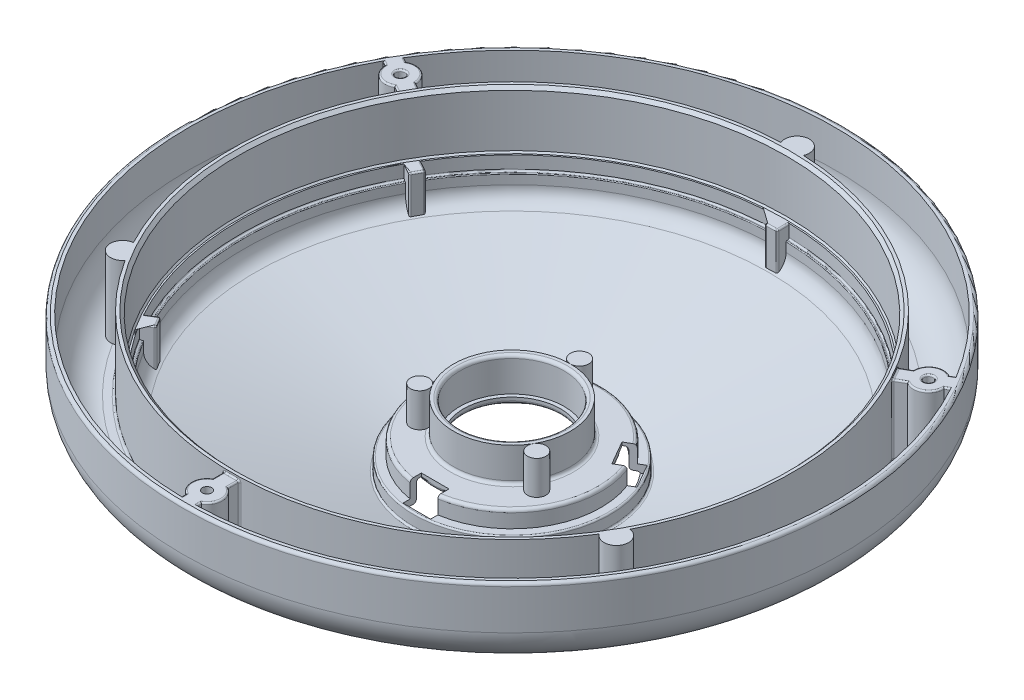
from build123d import *

# Parameters (mm, degrees)
SKETCH2_R             = 3.0000000000000036
BOSS_EXTRUDE3_DEPTH   = 11
SKETCH2_R_2           = 3.000000000000003
BOSS_EXTRUDE3_2_DEPTH = 11
BOSS_EXTRUDE3_3_DEPTH = 11
BOSS_EXTRUDE4_DEPTH   = 24
BOSS_EXTRUDE6_REACH   = 156.418
FILLET1_R             = 0.5
BOSS_EXTRUDE7_REACH   = 160.624
SKETCH8_R             = 1.5000000000000009
SKETCH8_R_2           = 1.4999999999999918
SKETCH8_R_3           = 1.5000000000000022
FILLET2_R             = 0.5
CUT_EXTRUDE1_DEPTH    = 8


with BuildPart() as part:
    # Sketch1 → Revolve1 (revolve)
    with BuildSketch(Plane.XY, mode=Mode.PRIVATE) as revolve1_sk:
        with BuildLine():
            Line((-106.26500000000001, 46.5), (-105.26500000000001, 46.5))
            Line((-105.26500000000001, 46.5), (-105.265, 34.50000000000008))
            ThreePointArc((-105.265, 34.50000000000008), (-102.04317459305202, 26.721825406947975), (-94.26499999999992, 23.500000000000004))
            Line((-94.26499999999992, 23.500000000000004), (-92.015, 23.500000000000004))
            ThreePointArc((-92.015, 23.500000000000004), (-91.48466991411009, 23.719669914110096), (-91.265, 24.250000000000007))
            Line((-91.265, 24.250000000000007), (-91.265, 47.5))
            Line((-91.265, 47.5), (-90.265, 47.5))
            Line((-90.265, 47.5), (-89.265, 46.5))
            Line((-89.265, 46.5), (-89.265, 29.500000000000004))
            Line((-89.265, 29.500000000000004), (-88.765, 29))
            Line((-88.765, 29), (-88.265, 29))
            Line((-88.265, 29), (-88.265, 25.000000000000004))
            ThreePointArc((-88.265, 25.000000000000004), (-88.11855339059328, 24.646446609406727), (-87.765, 24.5))
            Line((-87.765, 24.5), (-87.515, 24.5))
            ThreePointArc((-87.515, 24.5), (-87.33822330470336, 24.42677669529664), (-87.265, 24.25))
            Line((-87.265, 24.25), (-87.265, 21.290597645166347))
            ThreePointArc((-87.265, 21.290597645166347), (-86.24941764691893, 18.26993281521231), (-83.61523359403155, 16.476361543607876))
            Line((-83.61523359403155, 16.476361543607876), (-32.635023359403164, 2.1781029959422606))
            ThreePointArc((-32.635023359403164, 2.1781029959422606), (-32.1979335170046, 2.26108484140621), (-32, 2.6595266060981078))
            Line((-32, 2.6595266060981078), (-32, 5.999999999999996))
            ThreePointArc((-32, 5.999999999999996), (-31.853553390593277, 6.353553390593272), (-31.5, 6.5))
            Line((-31.5, 6.5), (-29, 6.5))
            Line((-29, 6.5), (-29, 10.999999999999993))
            ThreePointArc((-29, 10.999999999999993), (-28.70710678118655, 11.707106781186548), (-27.999999999999993, 12))
            Line((-27.999999999999993, 12), (-20.00000000000001, 12))
            ThreePointArc((-20.00000000000001, 12), (-19.292893218813454, 12.292893218813454), (-19.000000000000004, 13.000000000000009))
            Line((-19.000000000000004, 13.000000000000009), (-19.000000000000007, 23))
            Line((-19.000000000000007, 23), (-18.000000000000014, 23))
            ThreePointArc((-18.000000000000014, 23), (-17.29289321881346, 22.707106781186546), (-17.000000000000004, 21.999999999999993))
            Line((-17.000000000000004, 21.999999999999993), (-17.000000000000007, 12))
            Line((-17.000000000000007, 12), (-15.75, 12))
            Line((-15.75, 12), (-15.75, 11.000000000000009))
            ThreePointArc((-15.75, 11.000000000000009), (-16.04289321881345, 10.292893218813454), (-16.750000000000007, 10))
            Line((-16.750000000000007, 10), (-24.75, 10))
            ThreePointArc((-24.75, 10), (-24.92677669529664, 10.073223304703363), (-25, 10.250000000000002))
            Line((-25, 10.250000000000002), (-25, 10.499999999999995))
            ThreePointArc((-25, 10.499999999999995), (-25.146446609406727, 10.853553390593271), (-25.500000000000004, 11))
            Line((-25.500000000000004, 11), (-25.999999999999996, 11))
            ThreePointArc((-25.999999999999996, 11), (-26.707106781186553, 10.707106781186546), (-27.000000000000004, 9.999999999999991))
            Line((-27.000000000000004, 9.999999999999991), (-27.000000000000004, 5.500000000000006))
            ThreePointArc((-27.000000000000004, 5.500000000000006), (-27.292893218813457, 4.792893218813452), (-28.00000000000001, 4.5))
            Line((-28.00000000000001, 4.5), (-28.858251601619305, 4.500000000000001))
            ThreePointArc((-28.858251601619305, 4.500000000000001), (-29.565358382805854, 4.20710678118655), (-29.858251601619305, 3.5))
            Line((-29.858251601619305, 3.5), (-29.858251601619312, 0.6318155195259662))
            ThreePointArc((-29.858251601619312, 0.6318155195259662), (-30.047971579730543, 0.23973605306960133), (-30.473156833686136, 0.14519781778909666))
            Line((-30.473156833686136, 0.14519781778909666), (-87.41405232066815, 13.590674187989013))
            ThreePointArc((-87.41405232066815, 13.590674187989013), (-90.1857946645636, 15.354050986469991), (-91.265, 18.45685120535772))
            Line((-91.265, 18.45685120535772), (-91.265, 20.999999999999993))
            ThreePointArc((-91.265, 20.999999999999993), (-91.41144660940672, 21.353553390593273), (-91.765, 21.5))
            Line((-91.765, 21.5), (-96.26499999999993, 21.5))
            ThreePointArc((-96.26499999999993, 21.5), (-104.04317459305203, 24.72182540694797), (-107.265, 32.500000000000064))
            Line((-107.265, 32.500000000000064), (-107.26500000000001, 45.49999999999999))
            ThreePointArc((-107.26500000000001, 45.49999999999999), (-106.97210678118657, 46.207106781186546), (-106.26500000000001, 46.5))
        make_face()
    revolve(revolve1_sk.sketch.rotate(Axis((0, 0, 0), (0, 1, 0)), 270), axis=Axis((0, 0, 0), (0, 1, 0)))

    # Sketch3 → Boss-Extrude4 (add, through all)
    with BuildSketch(Plane(origin=(0, 23.500000000000004, 0), x_dir=(1, 0, 0), z_dir=(0, 1, 0))):
        with BuildLine():
            ThreePointArc((80.81225085960907, -42.41085163025632), (79.94126044781225, -44.03061551937523), (79.03780847638726, -45.63249999999917))
            ThreePointArc((79.03780847638726, -45.63249999999917), (78.10226180795067, -47.215854598665516), (77.13500033773872, -48.78003636629482))
            ThreePointArc((77.1350003377387, -48.78003636629483), (83.80094819720091, -48.382500000000384), (80.81225085960907, -42.41085163025633))
        make_face()
        with BuildLine():
            ThreePointArc((-77.13500033773943, -48.78003636629374), (-79.03780847638723, -45.632499999999226), (-80.81225085960966, -42.410851630255166))
            ThreePointArc((-80.81225085960965, -42.410851630255166), (-83.80094819720165, -48.38249999999917), (-77.13500033773943, -48.78003636629375))
        make_face()
        with BuildLine():
            ThreePointArc((-3.6772505218690332, 91.19088799655049), (1.26843e-12, 91.26499999999996), (3.6772505218715668, 91.19088799655034))
            ThreePointArc((3.6772505218715583, 91.19088799655033), (1.35947e-12, 96.7649999999999), (-3.677250521869044, 91.19088799655047))
        make_face()
    extrude(amount=BOSS_EXTRUDE4_DEPTH)

    # Sketch6 → Boss-Extrude6 (add, up to next)
    with BuildSketch(Plane(origin=(0, 29, 0), x_dir=(1, 0, 0), z_dir=(0, 1, 0)), mode=Mode.PRIVATE) as boss_extrude6_sk1:
        Polygon((71.99425942771423, -43.93083632540869), (75.50601778287276, -45.84592202975051), (77.42110348721458, -42.33416367459199), (73.90934513205603, -40.41907797025018), align=None)
    boss_extrude6_tool1 = extrude(boss_extrude6_sk1.sketch, amount=-BOSS_EXTRUDE6_REACH, mode=Mode.PRIVATE) - part.part
    # Sketch6 → Boss-Extrude6 (add, up to next)
    with BuildSketch(Plane(origin=(0, 29, 0), x_dir=(1, 0, 0), z_dir=(0, 1, 0)), mode=Mode.PRIVATE) as boss_extrude6_sk2:
        Polygon((-2.048090553443231, -84.31427575375221), (-1.9507242462483698, -88.31309055344269), (2.0480905534420653, -88.2157242462478), (1.950724246247211, -84.21690944655735), align=None)
    boss_extrude6_tool2 = extrude(boss_extrude6_sk2.sketch, amount=-BOSS_EXTRUDE6_REACH, mode=Mode.PRIVATE) - part.part
    # Sketch6 → Boss-Extrude6 (add, up to next)
    with BuildSketch(Plane(origin=(0, 29, 0), x_dir=(1, 0, 0), z_dir=(0, 1, 0)), mode=Mode.PRIVATE) as boss_extrude6_sk3:
        Polygon((-74.04234998115749, -40.38343942834317), (-77.4567420291212, -42.46716852369184), (-75.37301293377254, -45.881560571655505), (-71.95862088580884, -43.797831476306854), align=None)
    boss_extrude6_tool3 = extrude(boss_extrude6_sk3.sketch, amount=-BOSS_EXTRUDE6_REACH, mode=Mode.PRIVATE) - part.part
    # Sketch6 → Boss-Extrude6 (add, up to next)
    with BuildSketch(Plane(origin=(0, 29, 0), x_dir=(1, 0, 0), z_dir=(0, 1, 0)), mode=Mode.PRIVATE) as boss_extrude6_sk4:
        Polygon((-71.99425942771394, 43.9308363254092), (-75.5060177828725, 45.84592202975103), (-77.42110348721428, 42.33416367459251), (-73.90934513205576, 40.41907797025068), align=None)
    boss_extrude6_tool4 = extrude(boss_extrude6_sk4.sketch, amount=-BOSS_EXTRUDE6_REACH, mode=Mode.PRIVATE) - part.part
    # Sketch6 → Boss-Extrude6 (add, up to next)
    with BuildSketch(Plane(origin=(0, 29, 0), x_dir=(1, 0, 0), z_dir=(0, 1, 0)), mode=Mode.PRIVATE) as boss_extrude6_sk5:
        Polygon((2.048090553443835, 84.3142757537522), (1.9507242462490013, 88.31309055344266), (-2.048090553441434, 88.2157242462478), (-1.9507242462466072, 84.21690944655737), align=None)
    boss_extrude6_tool5 = extrude(boss_extrude6_sk5.sketch, amount=-BOSS_EXTRUDE6_REACH, mode=Mode.PRIVATE) - part.part
    # Sketch6 → Boss-Extrude6 (add, up to next)
    with BuildSketch(Plane(origin=(0, 29, 0), x_dir=(1, 0, 0), z_dir=(0, 1, 0)), mode=Mode.PRIVATE) as boss_extrude6_sk6:
        Polygon((74.04234998115774, 40.38343942834264), (77.45674202912147, 42.46716852369128), (75.37301293377286, 45.881560571654944), (71.95862088580915, 43.79783147630633), align=None)
    boss_extrude6_tool6 = extrude(boss_extrude6_sk6.sketch, amount=-BOSS_EXTRUDE6_REACH, mode=Mode.PRIVATE) - part.part
    add(boss_extrude6_tool1.solids().sort_by_distance((74.707681, 29, 43.1325))[0])
    add(boss_extrude6_tool2.solids().sort_by_distance((0, 29, 86.265))[0])
    add(boss_extrude6_tool3.solids().sort_by_distance((-74.707681, 29, 43.1325))[0])
    add(boss_extrude6_tool4.solids().sort_by_distance((-74.707681, 29, -43.1325))[0])
    add(boss_extrude6_tool5.solids().sort_by_distance((0, 29, -86.265))[0])
    add(boss_extrude6_tool6.solids().sort_by_distance((74.707681, 29, -43.1325))[0])

    # Fillet1
    fillet1_edges = [part.edges().sort_by_distance(p)[0] for p in [
        (2.000255796517047, 29, -86.27883967169635),
        (2.048090553443835, 22.87055087546162, -84.3142757537522),
        (0.04868315359861386, 29, -84.26559260015478),
        (-1.9507242462466072, 22.8484882948539, -84.21690944655737),
        (-1.9994073998440207, 29, -86.21631684640258),
        (75.71979486299225, 29, -41.407147501997144),
        (74.04234998115774, 22.87055087546161, -40.38343942834264),
        (73.00048543348345, 29, -42.090635452324484),
        (71.95862088580915, 22.848488294853897, -43.79783147630633),
        (73.665816909791, 29, -44.839696023980636),
        (73.7195390664755, 29, 44.87169216969829),
        (71.99425942771423, 22.870550875461614, 43.93083632540869),
        (73.90934513205603, 22.8484882948539, 40.41907797025018),
        (75.6652243096353, 29, 41.37662082242109),
        (72.95180227988513, 29, 42.17495714782943),
        (-2.048090553443231, 22.870550875461625, 84.31427575375221),
        (-2.00025579651643, 29, 86.27883967169636),
        (-0.04868315359801012, 29, 84.26559260015478),
        (1.950724246247211, 22.8484882948539, 84.21690944655735),
        (1.999407399844638, 29, 86.21631684640258),
        (-74.04234998115749, 22.87055087546162, 40.38343942834317),
        (-75.71979486299196, 29, 41.407147501997684),
        (-71.95862088580884, 22.8484882948539, 43.797831476306854),
        (-73.00048543348316, 29, 42.09063545232502),
        (-73.66581690979069, 29, 44.839696023981176),
        (-73.7195390664752, 29, -44.8716921696988),
        (-75.66522430963502, 29, -41.3766208224216),
        (-71.99425942771394, 22.87055087546162, -43.9308363254092),
        (-73.90934513205576, 22.8484882948539, -40.41907797025068),
        (-72.95180227988484, 29, -42.17495714782994),
    ]]
    fillet(fillet1_edges, radius=FILLET1_R)

    # Sketch8 → Boss-Extrude7 (add, up to next)
    with BuildSketch(Plane(origin=(0, 46.5, 0), x_dir=(1, 0, 0), z_dir=(0, 1, 0)), mode=Mode.PRIVATE) as boss_extrude7_sk1:
        with BuildLine():
            ThreePointArc((2.4999999999993614, -91.23075262760908), (-6.3849e-13, -91.26499999999999), (-2.5000000000006386, -91.23075262760905))
            Line((-2.5000000000006386, -91.23075262760905), (-2.5000000000006644, -94.93487298107819))
            ThreePointArc((-2.5000000000006626, -94.93487298107819), (-4.999999999999995, -99.26499999999996), (-2.500000000000727, -103.59512701892177))
            Line((-2.500000000000725, -103.59512701892177), (-2.500000000000736, -105.23530883215955))
            ThreePointArc((-2.500000000000736, -105.23530883215955), (-7.3586e-13, -105.265), (2.499999999999264, -105.23530883215959))
            Line((2.499999999999264, -105.23530883215957), (2.499999999999275, -103.59512701892261))
            ThreePointArc((2.4999999999992735, -103.59512701892261), (5.00000000000001, -99.26500000000003), (2.4999999999993374, -94.9348729810774))
            Line((2.4999999999993356, -94.9348729810774), (2.499999999999362, -91.23075262760908))
        make_face()
        with Locations(Location((9.8e-16, -99.26499999999999, 0), (0, 0, 270))):
            Circle(SKETCH8_R, mode=Mode.SUBTRACT)
    boss_extrude7_tool1 = extrude(boss_extrude7_sk1.sketch, amount=-BOSS_EXTRUDE7_REACH, mode=Mode.PRIVATE) - part.part
    # Sketch8 → Boss-Extrude7 (add, up to next)
    with BuildSketch(Plane(origin=(0, 46.5, 0), x_dir=(1, 0, 0), z_dir=(0, 1, 0)), mode=Mode.PRIVATE) as boss_extrude7_sk2:
        with BuildLine():
            Line((90.96601170666274, 49.6324999999983), (92.38645082375189, 50.45259090661717))
            ThreePointArc((92.38645082375189, 50.45259090661717), (91.16216412936976, 52.632499999998494), (89.88645082375194, 54.7827179255394))
            Line((89.88645082375194, 54.782717925539394), (88.46601170666351, 53.96262701892094))
            ThreePointArc((88.46601170666351, 53.96262701892094), (83.4660117066628, 53.96262701892143), (80.9660117066627, 49.63249999999846))
            Line((80.9660117066627, 49.63249999999846), (77.75814938188412, 47.78043982326434))
            ThreePointArc((77.75814938188412, 47.78043982326433), (79.03780847638751, 45.632499999998686), (80.25814938188404, 43.450312804342104))
            Line((80.25814938188405, 43.45031280434211), (83.46601170666335, 45.30237298107663))
            ThreePointArc((83.46601170666335, 45.30237298107663), (88.46601170666266, 45.30237298107695), (90.96601170666274, 49.6324999999983))
        make_face()
        with Locations(Location((85.96601170666273, 49.63249999999918, 0), (0, 0, 270))):
            Circle(SKETCH8_R_2, mode=Mode.SUBTRACT)
    boss_extrude7_tool2 = extrude(boss_extrude7_sk2.sketch, amount=-BOSS_EXTRUDE7_REACH, mode=Mode.PRIVATE) - part.part
    # Sketch8 → Boss-Extrude7 (add, up to next)
    with BuildSketch(Plane(origin=(0, 46.5, 0), x_dir=(1, 0, 0), z_dir=(0, 1, 0)), mode=Mode.PRIVATE) as boss_extrude7_sk3:
        with BuildLine():
            ThreePointArc((-89.8864508237505, 54.78271792554194), (-91.16216412936836, 52.63250000000107), (-92.38645082375052, 50.452590906619754))
            Line((-92.38645082375051, 50.452590906619754), (-90.96601170666209, 49.63250000000126))
            ThreePointArc((-90.96601170666209, 49.63250000000126), (-88.46601170666213, 45.302372981078236), (-83.46601170666143, 45.30237298107857))
            Line((-83.46601170666143, 45.30237298107857), (-80.25814938188289, 43.450312804344364))
            ThreePointArc((-80.2581493818829, 43.450312804344364), (-79.03780847638629, 45.63250000000092), (-77.75814938188284, 47.78043982326653))
            Line((-77.75814938188283, 47.78043982326653), (-80.96601170666207, 49.632500000001144))
            ThreePointArc((-80.96601170666206, 49.632500000001144), (-83.46601170666202, 53.96262701892257), (-88.46601170666133, 53.962627018923015))
            Line((-88.46601170666133, 53.96262701892302), (-89.88645082375048, 54.78271792554193))
        make_face()
        with Locations(Location((-85.96601170666209, 49.6325000000004, 0), (0, 0, 270))):
            Circle(SKETCH8_R_3, mode=Mode.SUBTRACT)
    boss_extrude7_tool3 = extrude(boss_extrude7_sk3.sketch, amount=-BOSS_EXTRUDE7_REACH, mode=Mode.PRIVATE) - part.part
    add(boss_extrude7_tool1.solids().sort_by_distance((2.327675, 46.5, 104.415218))[0])
    add(boss_extrude7_tool2.solids().sort_by_distance((81.769559, 46.5, -44.536595))[0])
    add(boss_extrude7_tool3.solids().sort_by_distance((-91.001912, 46.5, -52.539978))[0])

    # Fillet2
    fillet2_edges = [part.edges().sort_by_distance(p)[0] for p in [
        (80.66174626750905, 23.505619726843634, -49.456832266797996),
        (2.4999999999993383, 23.505619726843634, 94.58353751467645),
        (-80.66174626750805, 23.505619726843644, -49.45683226680046),
        (79.38254005385534, 23.500000000000004, -48.71828221499601),
        (2.4999999999993485, 23.500000000000004, 93.10643741107242),
        (-79.38254005385397, 23.500000000000004, -48.71828221499821),
        (77.9485028982774, 23.719620807980476, -47.89034047719518),
        (2.4999999999993485, 23.500000000000004, 93.10643741107242),
        (-77.9485028983477, 23.719620808074545, -47.89034047723872),
        (77.75814938188412, 35.375, -47.78043982326433),
        (2.4999999999993614, 35.375, 91.23075262760908),
        (-77.75814938188284, 35.375, -47.78043982326654),
        (79.03780847638753, 46.5, -45.6324999999987),
        (-6.3938e-13, 46.5, 91.26499999999999),
        (-79.03780847638629, 46.5, -45.63250000000092),
        (83.16174626750933, 23.505619726843648, -45.12670524787596),
        (81.88254005385527, 23.500000000000004, -44.38815519607377),
        (80.44850289827733, 23.719620807980473, -43.560213458272955),
        (-2.5000000000006617, 23.505619726843648, 94.58353751467683),
        (-2.500000000000652, 23.500000000000004, 93.10643741107239),
        (-2.500000000000652, 23.500000000000004, 93.10643741107239),
        (-83.16174626750775, 23.505619726843634, -45.126705247878085),
        (-81.88254005385403, 23.500000000000004, -44.38815519607604),
        (-80.44850289835281, 23.7196208080687, -43.56021345831947),
        (80.25814938188405, 35.375, -43.45031280434212),
        (89.17623126520772, 46.5, -54.372672472230164),
        (79.36208054427341, 46.5, -48.7064699116314),
        (83.4660117066628, 46.5, -53.96262701892143),
        (91.67623126520732, 46.5, -50.04254545330774),
        (81.86208054427371, 46.5, -44.376342892709374),
        (88.46601170666266, 46.5, -45.30237298107695),
        (85.96601170666273, 46.5, -51.132499999999176),
        (-85.96601170666209, 46.5, -51.1325000000004),
        (-2.5000000000006386, 35.375, 91.23075262760905),
        (-2.5000000000007305, 46.5, 104.41521792554066),
        (-2.5000000000006515, 46.5, 93.08281280434362),
        (-4.999999999999997, 46.5, 99.26499999999996),
        (2.499999999999349, 46.5, 93.08281280434323),
        (2.4999999999992695, 46.5, 104.4152179255411),
        (5.000000000000007, 46.5, 99.26500000000003),
        (-80.2581493818829, 35.375, -43.450312804344364),
        (-91.6762312652063, 46.5, -50.04254545331051),
        (-89.1762312652059, 46.5, -54.37267247223248),
        (-79.36208054427246, 46.5, -48.70646991163384),
        (-83.46601170666202, 46.5, -53.96262701892257),
        (-81.86208054427216, 46.5, -44.37634289271146),
        (-88.46601170666213, 46.5, -45.302372981078236),
    ]]
    fillet(fillet2_edges, radius=FILLET2_R)

    # Sketch9 → Cut-Extrude1 (cut)
    with BuildSketch(Plane(origin=(0, 12, 0), x_dir=(1, 0, 0), z_dir=(0, 1, 0))):
        with BuildLine():
            Line((24.59678751731763, 19.397114317029907), (21.683501624292376, 17.715127922465438))
            ThreePointArc((21.68350162429248, 17.715127922465165), (24.248711305964488, 13.999999999999627), (26.183501624292422, 9.920899288405046))
            Line((26.183501624292166, 9.920899288405366), (29.096787517317633, 11.60288568296996))
            Line((29.096787517317633, 11.60288568296996), (24.59678751731763, 19.397114317029907))
        make_face()
        with BuildLine():
            Line((21.683501624292376, 17.715127922465438), (19.400635094610994, 16.397114317029907))
            Line((19.400635094610994, 16.397114317029907), (23.900635094610998, 8.602885682969957))
            Line((23.900635094610998, 8.602885682969957), (26.183501624292166, 9.920899288405366))
            ThreePointArc((26.183501624292422, 9.920899288405046), (24.248711305964488, 13.999999999999627), (21.68350162429248, 17.715127922465165))
        make_face()
        with BuildLine():
            Line((-19.400635094610767, 16.397114317030223), (-21.683501624292113, 17.71512792246576))
            ThreePointArc((-21.683501624292223, 17.715127922465477), (-24.248711305964285, 13.999999999999984), (-26.183501624292273, 9.920899288405442))
            Line((-26.18350162429202, 9.920899288405757), (-23.900635094610845, 8.602885682970314))
            Line((-23.900635094610845, 8.602885682970314), (-19.400635094610767, 16.397114317030223))
        make_face()
        with BuildLine():
            ThreePointArc((-26.183501624292273, 9.920899288405442), (-24.248711305964285, 13.999999999999984), (-21.683501624292223, 17.715127922465477))
            Line((-21.683501624292113, 17.71512792246576), (-24.596787517317377, 19.397114317030272))
            Line((-24.596787517317377, 19.397114317030272), (-29.096787517317445, 11.602885682970363))
            Line((-29.096787517317445, 11.602885682970363), (-26.18350162429202, 9.920899288405757))
        make_face()
        with BuildLine():
            ThreePointArc((-4.500000000000251, -27.63602721087091), (-2.5383e-13, -27.999999999999993), (4.499999999999726, -27.636027210870992))
            Line((4.499999999999796, -27.636027210871003), (4.499999999999808, -25.000000000000014))
            Line((4.499999999999808, -25.000000000000014), (-4.500000000000195, -24.999999999999975))
            Line((-4.500000000000196, -24.999999999999975), (-4.500000000000208, -27.63602721087091))
        make_face()
        with BuildLine():
            Line((4.499999999999779, -31.00000000000002), (4.499999999999796, -27.636027210871003))
            ThreePointArc((4.499999999999726, -27.636027210870992), (-2.5383e-13, -27.999999999999993), (-4.500000000000251, -27.63602721087091))
            Line((-4.500000000000208, -27.63602721087091), (-4.500000000000223, -30.999999999999982))
            Line((-4.500000000000223, -30.999999999999982), (4.499999999999779, -31.00000000000002))
        make_face()
    extrude(amount=-CUT_EXTRUDE1_DEPTH, mode=Mode.SUBTRACT)


with BuildPart() as body_2:
    # Sketch2 → Boss-Extrude3 (new body)
    with BuildSketch(Plane(origin=(0, 12, 0), x_dir=(1, 0, 0), z_dir=(0, 1, 0))):
        with Locations(Location((0, 22.000000000000007, 0), (0, 0, 270))):
            Circle(SKETCH2_R)
    extrude(amount=BOSS_EXTRUDE3_DEPTH)


with BuildPart() as body_3:
    # Sketch2 → Boss-Extrude3 2 (new body)
    with BuildSketch(Plane(origin=(0, 12, 0), x_dir=(1, 0, 0), z_dir=(0, 1, 0))):
        with Locations(Location((19.052558883257607, -11.000000000000092, 0), (0, 0, 270))):
            Circle(SKETCH2_R_2)
    extrude(amount=BOSS_EXTRUDE3_2_DEPTH)


with BuildPart() as body_4:
    # Sketch2 → Boss-Extrude3 3 (new body)
    with BuildSketch(Plane(origin=(0, 12, 0), x_dir=(1, 0, 0), z_dir=(0, 1, 0))):
        with Locations(Location((-19.052558883257756, -10.999999999999826, 0), (0, 0, 270))):
            Circle(SKETCH2_R)
    extrude(amount=BOSS_EXTRUDE3_3_DEPTH)


solid = Compound([part.part, body_2.part, body_3.part, body_4.part])
